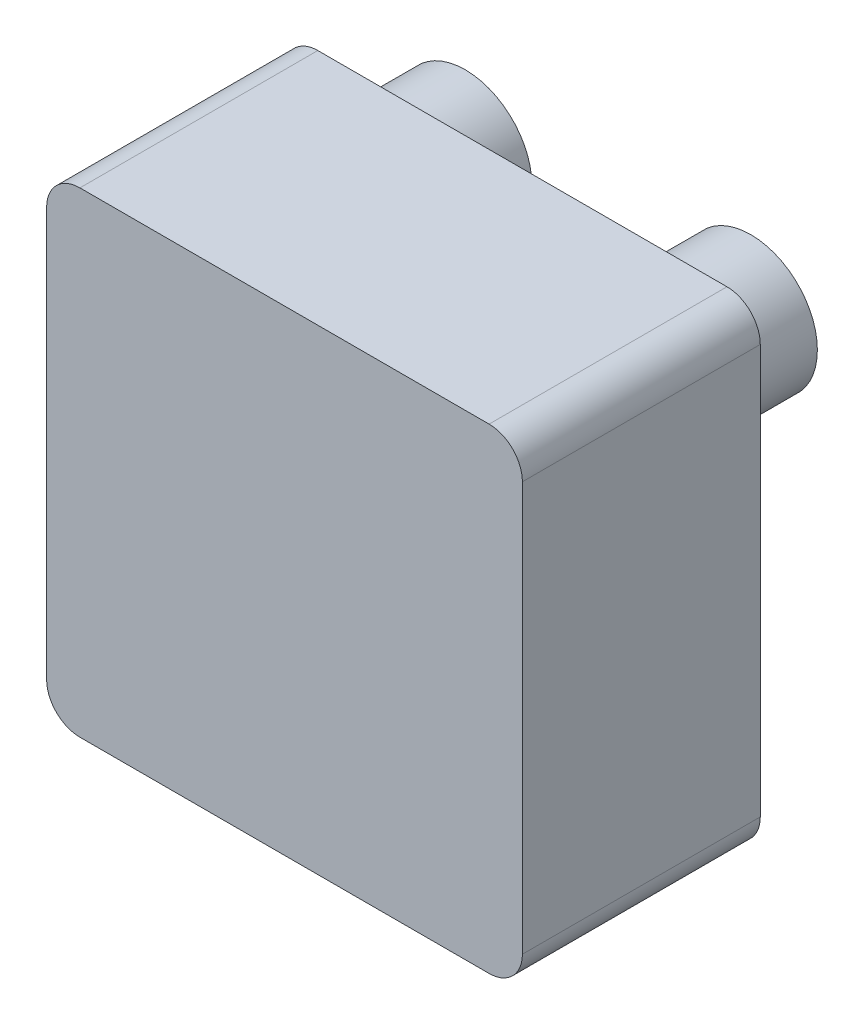
from build123d import *

# Parameters (mm, degrees)
SKETCH2_W           = 10
SKETCH2_H           = 5
BOSS_EXTRUDE2_DEPTH = 10
SKETCH3_R           = 1.4
BOSS_EXTRUDE3_DEPTH = 1.8
SKETCH4_W           = 2.35
SKETCH4_H           = 0.35
CUT_EXTRUDE1_DEPTH  = 5
SKETCH5_R           = 1.2
CUT_EXTRUDE2_DEPTH  = 3.5
FILLET1_R           = 0.7


with BuildPart() as part:
    # Sketch2 → Boss-Extrude2 (new body)
    with BuildSketch(Plane(origin=(0, 0, 0), x_dir=(1, 0, 0), z_dir=(0, 1, 0))):
        with Locations((5, 2.5)):
            Rectangle(SKETCH2_W, SKETCH2_H)
    extrude(amount=BOSS_EXTRUDE2_DEPTH)

    # Sketch3 → Boss-Extrude3 (add)
    with BuildSketch(Plane(origin=(0, 0, -5), x_dir=(-1, 0, 0), z_dir=(0, 0, -1))):
        with Locations((-8, 8)):
            Circle(SKETCH3_R)
        with Locations((-2, 8)):
            Circle(SKETCH3_R)
    extrude(amount=BOSS_EXTRUDE3_DEPTH)

    # Sketch4 → Cut-Extrude1 (cut)
    with BuildSketch(Plane.XZ):
        with Locations((3.175, -4.825)):
            Rectangle(SKETCH4_W, SKETCH4_H)
        with Locations((6.825, -4.825)):
            Rectangle(SKETCH4_W, SKETCH4_H)
    extrude(amount=-CUT_EXTRUDE1_DEPTH, mode=Mode.SUBTRACT)

    # Sketch5 → Cut-Extrude2 (cut)
    with BuildSketch(Plane.XZ):
        with Locations((5, -2.5)):
            Circle(SKETCH5_R)
    extrude(amount=-CUT_EXTRUDE2_DEPTH, mode=Mode.SUBTRACT)

    # Fillet1
    fillet1_edges = [part.edges().sort_by_distance(p)[0] for p in [
        (10, 0, -2.5),
        (0, 0, -2.5),
        (0, 10, -2.5),
        (10, 10, -2.5),
    ]]
    fillet(fillet1_edges, radius=FILLET1_R)


solid = part.part
